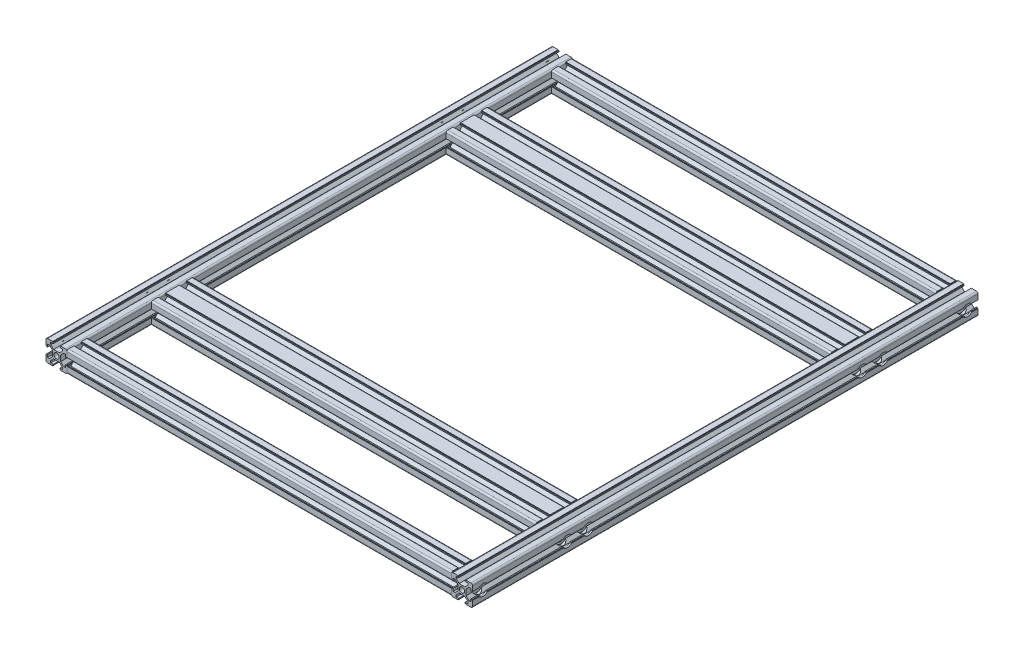
from build123d import *

# Parameters (mm, degrees)
SKETCH1_R                   = 2.5
F_20_X_20_X_R1_5_1_DEPTH    = 385
SKETCH1_ON_SEGMENT_2_R      = 2.5
F_20_X_20_X_R1_5_1_2_DEPTH  = 385
SKETCH110_R                 = 2.5
F_20_X_40_X_R1_5_3_DEPTH    = 385
SKETCH111_R                 = 2.5
F_20_X_40_X_R1_5_4_DEPTH    = 385
SKETCH114_ON_SEGMENT_1_R    = 2.5
F_20_X_20_X_R1_5_24_DEPTH   = 80
SKETCH114_R                 = 2.5
F_20_X_20_X_R1_5_24_2_DEPTH = 300
SKETCH114_ON_SEGMENT_3_R    = 2.5
F_20_X_20_X_R1_5_24_3_DEPTH = 80
SKETCH115_R                 = 2.5
F_20_X_20_X_R1_5_25_DEPTH   = 80
SKETCH115_ON_SEGMENT_2_R    = 2.5
F_20_X_20_X_R1_5_25_2_DEPTH = 300
SKETCH115_ON_SEGMENT_3_R    = 2.5
F_20_X_20_X_R1_5_25_3_DEPTH = 80
BODY_START                  = 80
BODY_7_RUN_ON_DEPTH         = 10
BODY_8_RUN_ON_DEPTH         = 10
BODY_5_RUN_ON_DEPTH         = 10
BODY_10_RUN_ON_DEPTH        = 10
SKETCH_16_R                 = 3.1
SKETCH_16_R_2               = 2.5
CUT_EXTRUDE_1_DEPTH         = 87
CUT_EXTRUDE_START           = -87
SKETCH_18_R                 = 2.5
SKETCH_18_R_2               = 3.1
CUT_EXTRUDE_2_DEPTH         = 87
SKETCH_19_R                 = 5.25
CUT_EXTRUDE_3_DEPTH         = 6.1
SKETCH_20_R                 = 5.25
CUT_EXTRUDE_4_DEPTH         = 6.1


with BuildPart() as part:
    # Sketch1 → 铝型材 20 X 20 X R1.5(1) (new body)
    with BuildSketch(Plane(origin=(-192.5, 0, -230), x_dir=(0, 0, -1), z_dir=(1, 0, 0))):
        with BuildLine():
            Line((-3.6, 10), (-3.6, 9.5))
            Line((-3.6, 9.5), (-3.1, 9.5))
            Line((-3.1, 9.5), (-3.1, 8.5))
            Line((-3.1, 8.5), (-5.5, 8.5))
            Line((-5.5, 8.5), (-5.5, 6.65))
            Line((-5.5, 6.65), (-2.75, 3.9))
            Line((-2.75, 3.9), (2.75, 3.9))
            Line((2.75, 3.9), (5.5, 6.65))
            Line((5.5, 6.65), (5.5, 8.5))
            Line((5.5, 8.5), (3.1, 8.5))
            Line((3.1, 8.5), (3.1, 9.5))
            Line((3.1, 9.5), (3.6, 9.5))
            Line((3.6, 9.5), (3.6, 10))
            Line((3.6, 10), (8.5, 10))
            ThreePointArc((8.5, 10), (9.560660172, 9.560660172), (10, 8.5))
            Line((10, 8.5), (10, 3.6))
            Line((10, 3.6), (9.5, 3.6))
            Line((9.5, 3.6), (9.5, 3.1))
            Line((9.5, 3.1), (8.5, 3.1))
            Line((8.5, 3.1), (8.5, 5.5))
            Line((8.5, 5.5), (6.65, 5.5))
            Line((6.65, 5.5), (3.9, 2.75))
            Line((3.9, 2.75), (3.9, -2.75))
            Line((3.9, -2.75), (6.65, -5.5))
            Line((6.65, -5.5), (8.5, -5.5))
            Line((8.5, -5.5), (8.5, -3.1))
            Line((8.5, -3.1), (9.5, -3.1))
            Line((9.5, -3.1), (9.5, -3.6))
            Line((9.5, -3.6), (10, -3.6))
            Line((10, -3.6), (10, -8.5))
            ThreePointArc((10, -8.5), (9.560660172, -9.560660172), (8.5, -10))
            Line((8.5, -10), (3.6, -10))
            Line((3.6, -10), (3.6, -9.5))
            Line((3.6, -9.5), (3.1, -9.5))
            Line((3.1, -9.5), (3.1, -8.5))
            Line((3.1, -8.5), (5.5, -8.5))
            Line((5.5, -8.5), (5.5, -6.65))
            Line((5.5, -6.65), (2.75, -3.9))
            Line((2.75, -3.9), (-2.75, -3.9))
            Line((-2.75, -3.9), (-5.5, -6.65))
            Line((-5.5, -6.65), (-5.5, -8.5))
            Line((-5.5, -8.5), (-3.1, -8.5))
            Line((-3.1, -8.5), (-3.1, -9.5))
            Line((-3.1, -9.5), (-3.6, -9.5))
            Line((-3.6, -9.5), (-3.6, -10))
            Line((-3.6, -10), (-8.5, -10))
            ThreePointArc((-8.5, -10), (-9.560660172, -9.560660172), (-10, -8.5))
            Line((-10, -8.5), (-10, -3.6))
            Line((-10, -3.6), (-9.5, -3.6))
            Line((-9.5, -3.6), (-9.5, -3.1))
            Line((-9.5, -3.1), (-8.5, -3.1))
            Line((-8.5, -3.1), (-8.5, -5.5))
            Line((-8.5, -5.5), (-6.65, -5.5))
            Line((-6.65, -5.5), (-3.9, -2.75))
            Line((-3.9, -2.75), (-3.9, 2.75))
            Line((-3.9, 2.75), (-6.65, 5.5))
            Line((-6.65, 5.5), (-8.5, 5.5))
            Line((-8.5, 5.5), (-8.5, 3.1))
            Line((-8.5, 3.1), (-9.5, 3.1))
            Line((-9.5, 3.1), (-9.5, 3.6))
            Line((-9.5, 3.6), (-10, 3.6))
            Line((-10, 3.6), (-10, 8.5))
            ThreePointArc((-10, 8.5), (-9.560660172, 9.560660172), (-8.5, 10))
            Line((-8.5, 10), (-3.6, 10))
        make_face()
        Circle(SKETCH1_R, mode=Mode.SUBTRACT)
    extrude(amount=F_20_X_20_X_R1_5_1_DEPTH)

    # Weld Trim 4
    split(bisect_by=Plane(origin=(-182.5, 6.05, 190), x_dir=(0, 1, 0), z_dir=(1, 0, 0)), keep=Keep.TOP)

    # Weld Trim 4 3
    split(bisect_by=Plane(origin=(182.5, 6.05, 190), x_dir=(0, -1, 0), z_dir=(-1, 0, 0)), keep=Keep.TOP)


with BuildPart() as body_2:
    # Sketch1 on segment 2 (carried to segment 2) → 20 X 20 X R1.5_1 2 (new body)
    with BuildSketch(Plane(origin=(-192.5, 0, 230), x_dir=(0, 0, -1), z_dir=(1, 0, 0))):
        with BuildLine():
            Line((-3.6, 10), (-3.6, 9.5))
            Line((-3.6, 9.5), (-3.1, 9.5))
            Line((-3.1, 9.5), (-3.1, 8.5))
            Line((-3.1, 8.5), (-5.5, 8.5))
            Line((-5.5, 8.5), (-5.5, 6.65))
            Line((-5.5, 6.65), (-2.75, 3.9))
            Line((-2.75, 3.9), (2.75, 3.9))
            Line((2.75, 3.9), (5.5, 6.65))
            Line((5.5, 6.65), (5.5, 8.5))
            Line((5.5, 8.5), (3.1, 8.5))
            Line((3.1, 8.5), (3.1, 9.5))
            Line((3.1, 9.5), (3.6, 9.5))
            Line((3.6, 9.5), (3.6, 10))
            Line((3.6, 10), (8.5, 10))
            ThreePointArc((8.5, 10), (9.560660172, 9.560660172), (10, 8.5))
            Line((10, 8.5), (10, 3.6))
            Line((10, 3.6), (9.5, 3.6))
            Line((9.5, 3.6), (9.5, 3.1))
            Line((9.5, 3.1), (8.5, 3.1))
            Line((8.5, 3.1), (8.5, 5.5))
            Line((8.5, 5.5), (6.65, 5.5))
            Line((6.65, 5.5), (3.9, 2.75))
            Line((3.9, 2.75), (3.9, -2.75))
            Line((3.9, -2.75), (6.65, -5.5))
            Line((6.65, -5.5), (8.5, -5.5))
            Line((8.5, -5.5), (8.5, -3.1))
            Line((8.5, -3.1), (9.5, -3.1))
            Line((9.5, -3.1), (9.5, -3.6))
            Line((9.5, -3.6), (10, -3.6))
            Line((10, -3.6), (10, -8.5))
            ThreePointArc((10, -8.5), (9.560660172, -9.560660172), (8.5, -10))
            Line((8.5, -10), (3.6, -10))
            Line((3.6, -10), (3.6, -9.5))
            Line((3.6, -9.5), (3.1, -9.5))
            Line((3.1, -9.5), (3.1, -8.5))
            Line((3.1, -8.5), (5.5, -8.5))
            Line((5.5, -8.5), (5.5, -6.65))
            Line((5.5, -6.65), (2.75, -3.9))
            Line((2.75, -3.9), (-2.75, -3.9))
            Line((-2.75, -3.9), (-5.5, -6.65))
            Line((-5.5, -6.65), (-5.5, -8.5))
            Line((-5.5, -8.5), (-3.1, -8.5))
            Line((-3.1, -8.5), (-3.1, -9.5))
            Line((-3.1, -9.5), (-3.6, -9.5))
            Line((-3.6, -9.5), (-3.6, -10))
            Line((-3.6, -10), (-8.5, -10))
            ThreePointArc((-8.5, -10), (-9.560660172, -9.560660172), (-10, -8.5))
            Line((-10, -8.5), (-10, -3.6))
            Line((-10, -3.6), (-9.5, -3.6))
            Line((-9.5, -3.6), (-9.5, -3.1))
            Line((-9.5, -3.1), (-8.5, -3.1))
            Line((-8.5, -3.1), (-8.5, -5.5))
            Line((-8.5, -5.5), (-6.65, -5.5))
            Line((-6.65, -5.5), (-3.9, -2.75))
            Line((-3.9, -2.75), (-3.9, 2.75))
            Line((-3.9, 2.75), (-6.65, 5.5))
            Line((-6.65, 5.5), (-8.5, 5.5))
            Line((-8.5, 5.5), (-8.5, 3.1))
            Line((-8.5, 3.1), (-9.5, 3.1))
            Line((-9.5, 3.1), (-9.5, 3.6))
            Line((-9.5, 3.6), (-10, 3.6))
            Line((-10, 3.6), (-10, 8.5))
            ThreePointArc((-10, 8.5), (-9.560660172, 9.560660172), (-8.5, 10))
            Line((-8.5, 10), (-3.6, 10))
        make_face()
        Circle(SKETCH1_ON_SEGMENT_2_R, mode=Mode.SUBTRACT)
    extrude(amount=F_20_X_20_X_R1_5_1_2_DEPTH)

    # Weld Trim 4
    split(bisect_by=Plane(origin=(-182.5, 6.05, 190), x_dir=(0, 1, 0), z_dir=(1, 0, 0)), keep=Keep.TOP)

    # Weld Trim 4 3
    split(bisect_by=Plane(origin=(182.5, 6.05, 190), x_dir=(0, -1, 0), z_dir=(-1, 0, 0)), keep=Keep.TOP)


with BuildPart() as body_3:
    # Sketch110 → 铝型材 20 X 40 X R1.5(3) (new body)
    with BuildSketch(Plane(origin=(-192.5, 0, 150), x_dir=(0, 1, 0), z_dir=(1, 0, 0))):
        with BuildLine():
            Line((-3.6, 10), (-3.6, 9.5))
            Line((-3.6, 9.5), (-3.1, 9.5))
            Line((-3.1, 9.5), (-3.1, 8.5))
            Line((-3.1, 8.5), (-5.5, 8.5))
            Line((-5.5, 8.5), (-5.5, 6.65))
            Line((-5.5, 6.65), (-2.75, 3.9))
            Line((-2.75, 3.9), (2.75, 3.9))
            Line((2.75, 3.9), (5.5, 6.65))
            Line((5.5, 6.65), (5.5, 8.5))
            Line((5.5, 8.5), (3.1, 8.5))
            Line((3.1, 8.5), (3.1, 9.5))
            Line((3.1, 9.5), (3.6, 9.5))
            Line((3.6, 9.5), (3.6, 10))
            Line((3.6, 10), (8.5, 10))
            ThreePointArc((8.5, 10), (9.560660172, 9.560660172), (10, 8.5))
            Line((10, 8.5), (10, 3.6))
            Line((10, 3.6), (9.5, 3.6))
            Line((9.5, 3.6), (9.5, 3.1))
            Line((9.5, 3.1), (8.5, 3.1))
            Line((8.5, 3.1), (8.5, 5.5))
            Line((8.5, 5.5), (6.65, 5.5))
            Line((6.65, 5.5), (3.9, 2.75))
            Line((3.9, 2.75), (3.9, -2.75))
            Line((3.9, -2.75), (6.65, -5.5))
            Line((6.65, -5.5), (8.5, -5.5))
            Line((8.5, -5.5), (8.5, -3.1))
            Line((8.5, -3.1), (9.5, -3.1))
            Line((9.5, -3.1), (9.5, -3.6))
            Line((9.5, -3.6), (10, -3.6))
            Line((10, -3.6), (10, -16.4))
            Line((10, -16.4), (9.5, -16.4))
            Line((9.5, -16.4), (9.5, -16.9))
            Line((9.5, -16.9), (8.5, -16.9))
            Line((8.5, -16.9), (8.5, -14.5))
            Line((8.5, -14.5), (6.65, -14.5))
            Line((6.65, -14.5), (3.9, -17.25))
            Line((3.9, -17.25), (3.9, -22.75))
            Line((3.9, -22.75), (6.65, -25.5))
            Line((6.65, -25.5), (8.5, -25.5))
            Line((8.5, -25.5), (8.5, -23.1))
            Line((8.5, -23.1), (9.5, -23.1))
            Line((9.5, -23.1), (9.5, -23.6))
            Line((9.5, -23.6), (10, -23.6))
            Line((10, -23.6), (10, -28.5))
            ThreePointArc((10, -28.5), (9.560660172, -29.560660172), (8.5, -30))
            Line((8.5, -30), (3.6, -30))
            Line((3.6, -30), (3.6, -29.5))
            Line((3.6, -29.5), (3.1, -29.5))
            Line((3.1, -29.5), (3.1, -28.5))
            Line((3.1, -28.5), (5.5, -28.5))
            Line((5.5, -28.5), (5.5, -26.65))
            Line((5.5, -26.65), (2.75, -23.9))
            Line((2.75, -23.9), (-2.75, -23.9))
            Line((-2.75, -23.9), (-5.5, -26.65))
            Line((-5.5, -26.65), (-5.5, -28.5))
            Line((-5.5, -28.5), (-3.1, -28.5))
            Line((-3.1, -28.5), (-3.1, -29.5))
            Line((-3.1, -29.5), (-3.6, -29.5))
            Line((-3.6, -29.5), (-3.6, -30))
            Line((-3.6, -30), (-8.5, -30))
            ThreePointArc((-8.5, -30), (-9.560660172, -29.560660172), (-10, -28.5))
            Line((-10, -28.5), (-10, -23.6))
            Line((-10, -23.6), (-9.5, -23.6))
            Line((-9.5, -23.6), (-9.5, -23.1))
            Line((-9.5, -23.1), (-8.5, -23.1))
            Line((-8.5, -23.1), (-8.5, -25.5))
            Line((-8.5, -25.5), (-6.65, -25.5))
            Line((-6.65, -25.5), (-3.9, -22.75))
            Line((-3.9, -22.75), (-3.9, -17.25))
            Line((-3.9, -17.25), (-6.65, -14.5))
            Line((-6.65, -14.5), (-8.5, -14.5))
            Line((-8.5, -14.5), (-8.5, -16.9))
            Line((-8.5, -16.9), (-9.5, -16.9))
            Line((-9.5, -16.9), (-9.5, -16.4))
            Line((-9.5, -16.4), (-10, -16.4))
            Line((-10, -16.4), (-10, -3.6))
            Line((-10, -3.6), (-9.5, -3.6))
            Line((-9.5, -3.6), (-9.5, -3.1))
            Line((-9.5, -3.1), (-8.5, -3.1))
            Line((-8.5, -3.1), (-8.5, -5.5))
            Line((-8.5, -5.5), (-6.65, -5.5))
            Line((-6.65, -5.5), (-3.9, -2.75))
            Line((-3.9, -2.75), (-3.9, 2.75))
            Line((-3.9, 2.75), (-6.65, 5.5))
            Line((-6.65, 5.5), (-8.5, 5.5))
            Line((-8.5, 5.5), (-8.5, 3.1))
            Line((-8.5, 3.1), (-9.5, 3.1))
            Line((-9.5, 3.1), (-9.5, 3.6))
            Line((-9.5, 3.6), (-10, 3.6))
            Line((-10, 3.6), (-10, 8.5))
            ThreePointArc((-10, 8.5), (-9.560660172, 9.560660172), (-8.5, 10))
            Line((-8.5, 10), (-3.6, 10))
        make_face()
        Circle(SKETCH110_R, mode=Mode.SUBTRACT)
        with Locations((0, -20)):
            Circle(SKETCH110_R, mode=Mode.SUBTRACT)
        Polygon((8.85, -10), (2.75, -3.9), (-2.75, -3.9), (-8.85, -10), (-2.75, -16.1), (2.75, -16.1), align=None, mode=Mode.SUBTRACT)
    extrude(amount=F_20_X_40_X_R1_5_3_DEPTH)

    # Weld Trim 3
    split(bisect_by=Plane(origin=(-182.5, 6.05, 190), x_dir=(0, 1, 0), z_dir=(1, 0, 0)), keep=Keep.TOP)

    # Weld Trim 3 3
    split(bisect_by=Plane(origin=(182.5, 6.05, 0), x_dir=(0, -1, 0), z_dir=(-1, 0, 0)), keep=Keep.TOP)


with BuildPart() as body_4:
    # Sketch111 → 铝型材 20 X 40 X R1.5(4) (new body)
    with BuildSketch(Plane(origin=(-192.5, 0, -150), x_dir=(0, -1, 0), z_dir=(1, 0, 0))):
        with BuildLine():
            Line((-3.6, 10), (-3.6, 9.5))
            Line((-3.6, 9.5), (-3.1, 9.5))
            Line((-3.1, 9.5), (-3.1, 8.5))
            Line((-3.1, 8.5), (-5.5, 8.5))
            Line((-5.5, 8.5), (-5.5, 6.65))
            Line((-5.5, 6.65), (-2.75, 3.9))
            Line((-2.75, 3.9), (2.75, 3.9))
            Line((2.75, 3.9), (5.5, 6.65))
            Line((5.5, 6.65), (5.5, 8.5))
            Line((5.5, 8.5), (3.1, 8.5))
            Line((3.1, 8.5), (3.1, 9.5))
            Line((3.1, 9.5), (3.6, 9.5))
            Line((3.6, 9.5), (3.6, 10))
            Line((3.6, 10), (8.5, 10))
            ThreePointArc((8.5, 10), (9.560660172, 9.560660172), (10, 8.5))
            Line((10, 8.5), (10, 3.6))
            Line((10, 3.6), (9.5, 3.6))
            Line((9.5, 3.6), (9.5, 3.1))
            Line((9.5, 3.1), (8.5, 3.1))
            Line((8.5, 3.1), (8.5, 5.5))
            Line((8.5, 5.5), (6.65, 5.5))
            Line((6.65, 5.5), (3.9, 2.75))
            Line((3.9, 2.75), (3.9, -2.75))
            Line((3.9, -2.75), (6.65, -5.5))
            Line((6.65, -5.5), (8.5, -5.5))
            Line((8.5, -5.5), (8.5, -3.1))
            Line((8.5, -3.1), (9.5, -3.1))
            Line((9.5, -3.1), (9.5, -3.6))
            Line((9.5, -3.6), (10, -3.6))
            Line((10, -3.6), (10, -16.4))
            Line((10, -16.4), (9.5, -16.4))
            Line((9.5, -16.4), (9.5, -16.9))
            Line((9.5, -16.9), (8.5, -16.9))
            Line((8.5, -16.9), (8.5, -14.5))
            Line((8.5, -14.5), (6.65, -14.5))
            Line((6.65, -14.5), (3.9, -17.25))
            Line((3.9, -17.25), (3.9, -22.75))
            Line((3.9, -22.75), (6.65, -25.5))
            Line((6.65, -25.5), (8.5, -25.5))
            Line((8.5, -25.5), (8.5, -23.1))
            Line((8.5, -23.1), (9.5, -23.1))
            Line((9.5, -23.1), (9.5, -23.6))
            Line((9.5, -23.6), (10, -23.6))
            Line((10, -23.6), (10, -28.5))
            ThreePointArc((10, -28.5), (9.560660172, -29.560660172), (8.5, -30))
            Line((8.5, -30), (3.6, -30))
            Line((3.6, -30), (3.6, -29.5))
            Line((3.6, -29.5), (3.1, -29.5))
            Line((3.1, -29.5), (3.1, -28.5))
            Line((3.1, -28.5), (5.5, -28.5))
            Line((5.5, -28.5), (5.5, -26.65))
            Line((5.5, -26.65), (2.75, -23.9))
            Line((2.75, -23.9), (-2.75, -23.9))
            Line((-2.75, -23.9), (-5.5, -26.65))
            Line((-5.5, -26.65), (-5.5, -28.5))
            Line((-5.5, -28.5), (-3.1, -28.5))
            Line((-3.1, -28.5), (-3.1, -29.5))
            Line((-3.1, -29.5), (-3.6, -29.5))
            Line((-3.6, -29.5), (-3.6, -30))
            Line((-3.6, -30), (-8.5, -30))
            ThreePointArc((-8.5, -30), (-9.560660172, -29.560660172), (-10, -28.5))
            Line((-10, -28.5), (-10, -23.6))
            Line((-10, -23.6), (-9.5, -23.6))
            Line((-9.5, -23.6), (-9.5, -23.1))
            Line((-9.5, -23.1), (-8.5, -23.1))
            Line((-8.5, -23.1), (-8.5, -25.5))
            Line((-8.5, -25.5), (-6.65, -25.5))
            Line((-6.65, -25.5), (-3.9, -22.75))
            Line((-3.9, -22.75), (-3.9, -17.25))
            Line((-3.9, -17.25), (-6.65, -14.5))
            Line((-6.65, -14.5), (-8.5, -14.5))
            Line((-8.5, -14.5), (-8.5, -16.9))
            Line((-8.5, -16.9), (-9.5, -16.9))
            Line((-9.5, -16.9), (-9.5, -16.4))
            Line((-9.5, -16.4), (-10, -16.4))
            Line((-10, -16.4), (-10, -3.6))
            Line((-10, -3.6), (-9.5, -3.6))
            Line((-9.5, -3.6), (-9.5, -3.1))
            Line((-9.5, -3.1), (-8.5, -3.1))
            Line((-8.5, -3.1), (-8.5, -5.5))
            Line((-8.5, -5.5), (-6.65, -5.5))
            Line((-6.65, -5.5), (-3.9, -2.75))
            Line((-3.9, -2.75), (-3.9, 2.75))
            Line((-3.9, 2.75), (-6.65, 5.5))
            Line((-6.65, 5.5), (-8.5, 5.5))
            Line((-8.5, 5.5), (-8.5, 3.1))
            Line((-8.5, 3.1), (-9.5, 3.1))
            Line((-9.5, 3.1), (-9.5, 3.6))
            Line((-9.5, 3.6), (-10, 3.6))
            Line((-10, 3.6), (-10, 8.5))
            ThreePointArc((-10, 8.5), (-9.560660172, 9.560660172), (-8.5, 10))
            Line((-8.5, 10), (-3.6, 10))
        make_face()
        Circle(SKETCH111_R, mode=Mode.SUBTRACT)
        with Locations((0, -20)):
            Circle(SKETCH111_R, mode=Mode.SUBTRACT)
        Polygon((8.85, -10), (2.75, -3.9), (-2.75, -3.9), (-8.85, -10), (-2.75, -16.1), (2.75, -16.1), align=None, mode=Mode.SUBTRACT)
    extrude(amount=F_20_X_40_X_R1_5_4_DEPTH)

    # Weld Trim 3
    split(bisect_by=Plane(origin=(-182.5, 6.05, 190), x_dir=(0, 1, 0), z_dir=(1, 0, 0)), keep=Keep.TOP)

    # Weld Trim 3 3
    split(bisect_by=Plane(origin=(182.5, 6.05, 0), x_dir=(0, -1, 0), z_dir=(-1, 0, 0)), keep=Keep.TOP)


with BuildPart() as body_5:
    # Sketch114 on segment 1 (carried to segment 1) → 铝型材 20 X 20 X R1.5(24) (new body)
    with BuildSketch(Plane(origin=(-192.5, 0, -230), x_dir=(1, 0, 0), z_dir=(0, 0, 1))):
        with BuildLine():
            Line((-3.6, 10), (-3.6, 9.5))
            Line((-3.6, 9.5), (-3.1, 9.5))
            Line((-3.1, 9.5), (-3.1, 8.5))
            Line((-3.1, 8.5), (-5.5, 8.5))
            Line((-5.5, 8.5), (-5.5, 6.65))
            Line((-5.5, 6.65), (-2.75, 3.9))
            Line((-2.75, 3.9), (2.75, 3.9))
            Line((2.75, 3.9), (5.5, 6.65))
            Line((5.5, 6.65), (5.5, 8.5))
            Line((5.5, 8.5), (3.1, 8.5))
            Line((3.1, 8.5), (3.1, 9.5))
            Line((3.1, 9.5), (3.6, 9.5))
            Line((3.6, 9.5), (3.6, 10))
            Line((3.6, 10), (8.5, 10))
            ThreePointArc((8.5, 10), (9.560660172, 9.560660172), (10, 8.5))
            Line((10, 8.5), (10, 3.6))
            Line((10, 3.6), (9.5, 3.6))
            Line((9.5, 3.6), (9.5, 3.1))
            Line((9.5, 3.1), (8.5, 3.1))
            Line((8.5, 3.1), (8.5, 5.5))
            Line((8.5, 5.5), (6.65, 5.5))
            Line((6.65, 5.5), (3.9, 2.75))
            Line((3.9, 2.75), (3.9, -2.75))
            Line((3.9, -2.75), (6.65, -5.5))
            Line((6.65, -5.5), (8.5, -5.5))
            Line((8.5, -5.5), (8.5, -3.1))
            Line((8.5, -3.1), (9.5, -3.1))
            Line((9.5, -3.1), (9.5, -3.6))
            Line((9.5, -3.6), (10, -3.6))
            Line((10, -3.6), (10, -8.5))
            ThreePointArc((10, -8.5), (9.560660172, -9.560660172), (8.5, -10))
            Line((8.5, -10), (3.6, -10))
            Line((3.6, -10), (3.6, -9.5))
            Line((3.6, -9.5), (3.1, -9.5))
            Line((3.1, -9.5), (3.1, -8.5))
            Line((3.1, -8.5), (5.5, -8.5))
            Line((5.5, -8.5), (5.5, -6.65))
            Line((5.5, -6.65), (2.75, -3.9))
            Line((2.75, -3.9), (-2.75, -3.9))
            Line((-2.75, -3.9), (-5.5, -6.65))
            Line((-5.5, -6.65), (-5.5, -8.5))
            Line((-5.5, -8.5), (-3.1, -8.5))
            Line((-3.1, -8.5), (-3.1, -9.5))
            Line((-3.1, -9.5), (-3.6, -9.5))
            Line((-3.6, -9.5), (-3.6, -10))
            Line((-3.6, -10), (-8.5, -10))
            ThreePointArc((-8.5, -10), (-9.560660172, -9.560660172), (-10, -8.5))
            Line((-10, -8.5), (-10, -3.6))
            Line((-10, -3.6), (-9.5, -3.6))
            Line((-9.5, -3.6), (-9.5, -3.1))
            Line((-9.5, -3.1), (-8.5, -3.1))
            Line((-8.5, -3.1), (-8.5, -5.5))
            Line((-8.5, -5.5), (-6.65, -5.5))
            Line((-6.65, -5.5), (-3.9, -2.75))
            Line((-3.9, -2.75), (-3.9, 2.75))
            Line((-3.9, 2.75), (-6.65, 5.5))
            Line((-6.65, 5.5), (-8.5, 5.5))
            Line((-8.5, 5.5), (-8.5, 3.1))
            Line((-8.5, 3.1), (-9.5, 3.1))
            Line((-9.5, 3.1), (-9.5, 3.6))
            Line((-9.5, 3.6), (-10, 3.6))
            Line((-10, 3.6), (-10, 8.5))
            ThreePointArc((-10, 8.5), (-9.560660172, 9.560660172), (-8.5, 10))
            Line((-8.5, 10), (-3.6, 10))
        make_face()
        Circle(SKETCH114_ON_SEGMENT_1_R, mode=Mode.SUBTRACT)
    extrude(amount=F_20_X_20_X_R1_5_24_DEPTH)

    # Sketch114 on segment 1 (carried to segment 1) → body 5 run on (add)
    with BuildSketch(Plane(origin=(-192.5, 0, -230), x_dir=(1, 0, 0), z_dir=(0, 0, 1))):
        with BuildLine():
            Line((-3.6, 10), (-3.6, 9.5))
            Line((-3.6, 9.5), (-3.1, 9.5))
            Line((-3.1, 9.5), (-3.1, 8.5))
            Line((-3.1, 8.5), (-5.5, 8.5))
            Line((-5.5, 8.5), (-5.5, 6.65))
            Line((-5.5, 6.65), (-2.75, 3.9))
            Line((-2.75, 3.9), (2.75, 3.9))
            Line((2.75, 3.9), (5.5, 6.65))
            Line((5.5, 6.65), (5.5, 8.5))
            Line((5.5, 8.5), (3.1, 8.5))
            Line((3.1, 8.5), (3.1, 9.5))
            Line((3.1, 9.5), (3.6, 9.5))
            Line((3.6, 9.5), (3.6, 10))
            Line((3.6, 10), (8.5, 10))
            ThreePointArc((8.5, 10), (9.560660172, 9.560660172), (10, 8.5))
            Line((10, 8.5), (10, 3.6))
            Line((10, 3.6), (9.5, 3.6))
            Line((9.5, 3.6), (9.5, 3.1))
            Line((9.5, 3.1), (8.5, 3.1))
            Line((8.5, 3.1), (8.5, 5.5))
            Line((8.5, 5.5), (6.65, 5.5))
            Line((6.65, 5.5), (3.9, 2.75))
            Line((3.9, 2.75), (3.9, -2.75))
            Line((3.9, -2.75), (6.65, -5.5))
            Line((6.65, -5.5), (8.5, -5.5))
            Line((8.5, -5.5), (8.5, -3.1))
            Line((8.5, -3.1), (9.5, -3.1))
            Line((9.5, -3.1), (9.5, -3.6))
            Line((9.5, -3.6), (10, -3.6))
            Line((10, -3.6), (10, -8.5))
            ThreePointArc((10, -8.5), (9.560660172, -9.560660172), (8.5, -10))
            Line((8.5, -10), (3.6, -10))
            Line((3.6, -10), (3.6, -9.5))
            Line((3.6, -9.5), (3.1, -9.5))
            Line((3.1, -9.5), (3.1, -8.5))
            Line((3.1, -8.5), (5.5, -8.5))
            Line((5.5, -8.5), (5.5, -6.65))
            Line((5.5, -6.65), (2.75, -3.9))
            Line((2.75, -3.9), (-2.75, -3.9))
            Line((-2.75, -3.9), (-5.5, -6.65))
            Line((-5.5, -6.65), (-5.5, -8.5))
            Line((-5.5, -8.5), (-3.1, -8.5))
            Line((-3.1, -8.5), (-3.1, -9.5))
            Line((-3.1, -9.5), (-3.6, -9.5))
            Line((-3.6, -9.5), (-3.6, -10))
            Line((-3.6, -10), (-8.5, -10))
            ThreePointArc((-8.5, -10), (-9.560660172, -9.560660172), (-10, -8.5))
            Line((-10, -8.5), (-10, -3.6))
            Line((-10, -3.6), (-9.5, -3.6))
            Line((-9.5, -3.6), (-9.5, -3.1))
            Line((-9.5, -3.1), (-8.5, -3.1))
            Line((-8.5, -3.1), (-8.5, -5.5))
            Line((-8.5, -5.5), (-6.65, -5.5))
            Line((-6.65, -5.5), (-3.9, -2.75))
            Line((-3.9, -2.75), (-3.9, 2.75))
            Line((-3.9, 2.75), (-6.65, 5.5))
            Line((-6.65, 5.5), (-8.5, 5.5))
            Line((-8.5, 5.5), (-8.5, 3.1))
            Line((-8.5, 3.1), (-9.5, 3.1))
            Line((-9.5, 3.1), (-9.5, 3.6))
            Line((-9.5, 3.6), (-10, 3.6))
            Line((-10, 3.6), (-10, 8.5))
            ThreePointArc((-10, 8.5), (-9.560660172, 9.560660172), (-8.5, 10))
            Line((-8.5, 10), (-3.6, 10))
        make_face()
        Circle(SKETCH114_ON_SEGMENT_1_R, mode=Mode.SUBTRACT)
    extrude(amount=-BODY_5_RUN_ON_DEPTH)


with BuildPart() as body_6:
    # Sketch114 → 20 X 20 X R1.5_24 2 (new body)
    with BuildSketch(Plane(origin=(-192.5, 0, 150), x_dir=(1, 0, 0), z_dir=(0, 0, 1))):
        with BuildLine():
            Line((-3.6, 10), (-3.6, 9.5))
            Line((-3.6, 9.5), (-3.1, 9.5))
            Line((-3.1, 9.5), (-3.1, 8.5))
            Line((-3.1, 8.5), (-5.5, 8.5))
            Line((-5.5, 8.5), (-5.5, 6.65))
            Line((-5.5, 6.65), (-2.75, 3.9))
            Line((-2.75, 3.9), (2.75, 3.9))
            Line((2.75, 3.9), (5.5, 6.65))
            Line((5.5, 6.65), (5.5, 8.5))
            Line((5.5, 8.5), (3.1, 8.5))
            Line((3.1, 8.5), (3.1, 9.5))
            Line((3.1, 9.5), (3.6, 9.5))
            Line((3.6, 9.5), (3.6, 10))
            Line((3.6, 10), (8.5, 10))
            ThreePointArc((8.5, 10), (9.560660172, 9.560660172), (10, 8.5))
            Line((10, 8.5), (10, 3.6))
            Line((10, 3.6), (9.5, 3.6))
            Line((9.5, 3.6), (9.5, 3.1))
            Line((9.5, 3.1), (8.5, 3.1))
            Line((8.5, 3.1), (8.5, 5.5))
            Line((8.5, 5.5), (6.65, 5.5))
            Line((6.65, 5.5), (3.9, 2.75))
            Line((3.9, 2.75), (3.9, -2.75))
            Line((3.9, -2.75), (6.65, -5.5))
            Line((6.65, -5.5), (8.5, -5.5))
            Line((8.5, -5.5), (8.5, -3.1))
            Line((8.5, -3.1), (9.5, -3.1))
            Line((9.5, -3.1), (9.5, -3.6))
            Line((9.5, -3.6), (10, -3.6))
            Line((10, -3.6), (10, -8.5))
            ThreePointArc((10, -8.5), (9.560660172, -9.560660172), (8.5, -10))
            Line((8.5, -10), (3.6, -10))
            Line((3.6, -10), (3.6, -9.5))
            Line((3.6, -9.5), (3.1, -9.5))
            Line((3.1, -9.5), (3.1, -8.5))
            Line((3.1, -8.5), (5.5, -8.5))
            Line((5.5, -8.5), (5.5, -6.65))
            Line((5.5, -6.65), (2.75, -3.9))
            Line((2.75, -3.9), (-2.75, -3.9))
            Line((-2.75, -3.9), (-5.5, -6.65))
            Line((-5.5, -6.65), (-5.5, -8.5))
            Line((-5.5, -8.5), (-3.1, -8.5))
            Line((-3.1, -8.5), (-3.1, -9.5))
            Line((-3.1, -9.5), (-3.6, -9.5))
            Line((-3.6, -9.5), (-3.6, -10))
            Line((-3.6, -10), (-8.5, -10))
            ThreePointArc((-8.5, -10), (-9.560660172, -9.560660172), (-10, -8.5))
            Line((-10, -8.5), (-10, -3.6))
            Line((-10, -3.6), (-9.5, -3.6))
            Line((-9.5, -3.6), (-9.5, -3.1))
            Line((-9.5, -3.1), (-8.5, -3.1))
            Line((-8.5, -3.1), (-8.5, -5.5))
            Line((-8.5, -5.5), (-6.65, -5.5))
            Line((-6.65, -5.5), (-3.9, -2.75))
            Line((-3.9, -2.75), (-3.9, 2.75))
            Line((-3.9, 2.75), (-6.65, 5.5))
            Line((-6.65, 5.5), (-8.5, 5.5))
            Line((-8.5, 5.5), (-8.5, 3.1))
            Line((-8.5, 3.1), (-9.5, 3.1))
            Line((-9.5, 3.1), (-9.5, 3.6))
            Line((-9.5, 3.6), (-10, 3.6))
            Line((-10, 3.6), (-10, 8.5))
            ThreePointArc((-10, 8.5), (-9.560660172, 9.560660172), (-8.5, 10))
            Line((-8.5, 10), (-3.6, 10))
        make_face()
        Circle(SKETCH114_R, mode=Mode.SUBTRACT)
    extrude(amount=-F_20_X_20_X_R1_5_24_2_DEPTH)


with BuildPart() as body_7:
    # Sketch114 on segment 3 (carried to segment 3) → 20 X 20 X R1.5_24 3 (new body)
    with BuildSketch(Plane(origin=(-192.5, 0, 150), x_dir=(1, 0, 0), z_dir=(0, 0, 1))):
        with BuildLine():
            Line((-3.6, 10), (-3.6, 9.5))
            Line((-3.6, 9.5), (-3.1, 9.5))
            Line((-3.1, 9.5), (-3.1, 8.5))
            Line((-3.1, 8.5), (-5.5, 8.5))
            Line((-5.5, 8.5), (-5.5, 6.65))
            Line((-5.5, 6.65), (-2.75, 3.9))
            Line((-2.75, 3.9), (2.75, 3.9))
            Line((2.75, 3.9), (5.5, 6.65))
            Line((5.5, 6.65), (5.5, 8.5))
            Line((5.5, 8.5), (3.1, 8.5))
            Line((3.1, 8.5), (3.1, 9.5))
            Line((3.1, 9.5), (3.6, 9.5))
            Line((3.6, 9.5), (3.6, 10))
            Line((3.6, 10), (8.5, 10))
            ThreePointArc((8.5, 10), (9.560660172, 9.560660172), (10, 8.5))
            Line((10, 8.5), (10, 3.6))
            Line((10, 3.6), (9.5, 3.6))
            Line((9.5, 3.6), (9.5, 3.1))
            Line((9.5, 3.1), (8.5, 3.1))
            Line((8.5, 3.1), (8.5, 5.5))
            Line((8.5, 5.5), (6.65, 5.5))
            Line((6.65, 5.5), (3.9, 2.75))
            Line((3.9, 2.75), (3.9, -2.75))
            Line((3.9, -2.75), (6.65, -5.5))
            Line((6.65, -5.5), (8.5, -5.5))
            Line((8.5, -5.5), (8.5, -3.1))
            Line((8.5, -3.1), (9.5, -3.1))
            Line((9.5, -3.1), (9.5, -3.6))
            Line((9.5, -3.6), (10, -3.6))
            Line((10, -3.6), (10, -8.5))
            ThreePointArc((10, -8.5), (9.560660172, -9.560660172), (8.5, -10))
            Line((8.5, -10), (3.6, -10))
            Line((3.6, -10), (3.6, -9.5))
            Line((3.6, -9.5), (3.1, -9.5))
            Line((3.1, -9.5), (3.1, -8.5))
            Line((3.1, -8.5), (5.5, -8.5))
            Line((5.5, -8.5), (5.5, -6.65))
            Line((5.5, -6.65), (2.75, -3.9))
            Line((2.75, -3.9), (-2.75, -3.9))
            Line((-2.75, -3.9), (-5.5, -6.65))
            Line((-5.5, -6.65), (-5.5, -8.5))
            Line((-5.5, -8.5), (-3.1, -8.5))
            Line((-3.1, -8.5), (-3.1, -9.5))
            Line((-3.1, -9.5), (-3.6, -9.5))
            Line((-3.6, -9.5), (-3.6, -10))
            Line((-3.6, -10), (-8.5, -10))
            ThreePointArc((-8.5, -10), (-9.560660172, -9.560660172), (-10, -8.5))
            Line((-10, -8.5), (-10, -3.6))
            Line((-10, -3.6), (-9.5, -3.6))
            Line((-9.5, -3.6), (-9.5, -3.1))
            Line((-9.5, -3.1), (-8.5, -3.1))
            Line((-8.5, -3.1), (-8.5, -5.5))
            Line((-8.5, -5.5), (-6.65, -5.5))
            Line((-6.65, -5.5), (-3.9, -2.75))
            Line((-3.9, -2.75), (-3.9, 2.75))
            Line((-3.9, 2.75), (-6.65, 5.5))
            Line((-6.65, 5.5), (-8.5, 5.5))
            Line((-8.5, 5.5), (-8.5, 3.1))
            Line((-8.5, 3.1), (-9.5, 3.1))
            Line((-9.5, 3.1), (-9.5, 3.6))
            Line((-9.5, 3.6), (-10, 3.6))
            Line((-10, 3.6), (-10, 8.5))
            ThreePointArc((-10, 8.5), (-9.560660172, 9.560660172), (-8.5, 10))
            Line((-8.5, 10), (-3.6, 10))
        make_face()
        Circle(SKETCH114_ON_SEGMENT_3_R, mode=Mode.SUBTRACT)
    extrude(amount=F_20_X_20_X_R1_5_24_3_DEPTH)

    # Sketch114 on segment 3 (carried to segment 3) → body 7 run on (add)
    with BuildSketch(Plane(origin=(-192.5, 0, 150), x_dir=(1, 0, 0), z_dir=(0, 0, 1)).offset(BODY_START)):
        with BuildLine():
            Line((-3.6, 10), (-3.6, 9.5))
            Line((-3.6, 9.5), (-3.1, 9.5))
            Line((-3.1, 9.5), (-3.1, 8.5))
            Line((-3.1, 8.5), (-5.5, 8.5))
            Line((-5.5, 8.5), (-5.5, 6.65))
            Line((-5.5, 6.65), (-2.75, 3.9))
            Line((-2.75, 3.9), (2.75, 3.9))
            Line((2.75, 3.9), (5.5, 6.65))
            Line((5.5, 6.65), (5.5, 8.5))
            Line((5.5, 8.5), (3.1, 8.5))
            Line((3.1, 8.5), (3.1, 9.5))
            Line((3.1, 9.5), (3.6, 9.5))
            Line((3.6, 9.5), (3.6, 10))
            Line((3.6, 10), (8.5, 10))
            ThreePointArc((8.5, 10), (9.560660172, 9.560660172), (10, 8.5))
            Line((10, 8.5), (10, 3.6))
            Line((10, 3.6), (9.5, 3.6))
            Line((9.5, 3.6), (9.5, 3.1))
            Line((9.5, 3.1), (8.5, 3.1))
            Line((8.5, 3.1), (8.5, 5.5))
            Line((8.5, 5.5), (6.65, 5.5))
            Line((6.65, 5.5), (3.9, 2.75))
            Line((3.9, 2.75), (3.9, -2.75))
            Line((3.9, -2.75), (6.65, -5.5))
            Line((6.65, -5.5), (8.5, -5.5))
            Line((8.5, -5.5), (8.5, -3.1))
            Line((8.5, -3.1), (9.5, -3.1))
            Line((9.5, -3.1), (9.5, -3.6))
            Line((9.5, -3.6), (10, -3.6))
            Line((10, -3.6), (10, -8.5))
            ThreePointArc((10, -8.5), (9.560660172, -9.560660172), (8.5, -10))
            Line((8.5, -10), (3.6, -10))
            Line((3.6, -10), (3.6, -9.5))
            Line((3.6, -9.5), (3.1, -9.5))
            Line((3.1, -9.5), (3.1, -8.5))
            Line((3.1, -8.5), (5.5, -8.5))
            Line((5.5, -8.5), (5.5, -6.65))
            Line((5.5, -6.65), (2.75, -3.9))
            Line((2.75, -3.9), (-2.75, -3.9))
            Line((-2.75, -3.9), (-5.5, -6.65))
            Line((-5.5, -6.65), (-5.5, -8.5))
            Line((-5.5, -8.5), (-3.1, -8.5))
            Line((-3.1, -8.5), (-3.1, -9.5))
            Line((-3.1, -9.5), (-3.6, -9.5))
            Line((-3.6, -9.5), (-3.6, -10))
            Line((-3.6, -10), (-8.5, -10))
            ThreePointArc((-8.5, -10), (-9.560660172, -9.560660172), (-10, -8.5))
            Line((-10, -8.5), (-10, -3.6))
            Line((-10, -3.6), (-9.5, -3.6))
            Line((-9.5, -3.6), (-9.5, -3.1))
            Line((-9.5, -3.1), (-8.5, -3.1))
            Line((-8.5, -3.1), (-8.5, -5.5))
            Line((-8.5, -5.5), (-6.65, -5.5))
            Line((-6.65, -5.5), (-3.9, -2.75))
            Line((-3.9, -2.75), (-3.9, 2.75))
            Line((-3.9, 2.75), (-6.65, 5.5))
            Line((-6.65, 5.5), (-8.5, 5.5))
            Line((-8.5, 5.5), (-8.5, 3.1))
            Line((-8.5, 3.1), (-9.5, 3.1))
            Line((-9.5, 3.1), (-9.5, 3.6))
            Line((-9.5, 3.6), (-10, 3.6))
            Line((-10, 3.6), (-10, 8.5))
            ThreePointArc((-10, 8.5), (-9.560660172, 9.560660172), (-8.5, 10))
            Line((-8.5, 10), (-3.6, 10))
        make_face()
        Circle(SKETCH114_ON_SEGMENT_3_R, mode=Mode.SUBTRACT)
    extrude(amount=BODY_7_RUN_ON_DEPTH)


with BuildPart() as body_8:
    # Sketch115 → 铝型材 20 X 20 X R1.5(25) (new body)
    with BuildSketch(Plane(origin=(192.5, 0, 230), x_dir=(-1, 0, 0), z_dir=(0, 0, -1))):
        with BuildLine():
            Line((-3.6, 10), (-3.6, 9.5))
            Line((-3.6, 9.5), (-3.1, 9.5))
            Line((-3.1, 9.5), (-3.1, 8.5))
            Line((-3.1, 8.5), (-5.5, 8.5))
            Line((-5.5, 8.5), (-5.5, 6.65))
            Line((-5.5, 6.65), (-2.75, 3.9))
            Line((-2.75, 3.9), (2.75, 3.9))
            Line((2.75, 3.9), (5.5, 6.65))
            Line((5.5, 6.65), (5.5, 8.5))
            Line((5.5, 8.5), (3.1, 8.5))
            Line((3.1, 8.5), (3.1, 9.5))
            Line((3.1, 9.5), (3.6, 9.5))
            Line((3.6, 9.5), (3.6, 10))
            Line((3.6, 10), (8.5, 10))
            ThreePointArc((8.5, 10), (9.560660172, 9.560660172), (10, 8.5))
            Line((10, 8.5), (10, 3.6))
            Line((10, 3.6), (9.5, 3.6))
            Line((9.5, 3.6), (9.5, 3.1))
            Line((9.5, 3.1), (8.5, 3.1))
            Line((8.5, 3.1), (8.5, 5.5))
            Line((8.5, 5.5), (6.65, 5.5))
            Line((6.65, 5.5), (3.9, 2.75))
            Line((3.9, 2.75), (3.9, -2.75))
            Line((3.9, -2.75), (6.65, -5.5))
            Line((6.65, -5.5), (8.5, -5.5))
            Line((8.5, -5.5), (8.5, -3.1))
            Line((8.5, -3.1), (9.5, -3.1))
            Line((9.5, -3.1), (9.5, -3.6))
            Line((9.5, -3.6), (10, -3.6))
            Line((10, -3.6), (10, -8.5))
            ThreePointArc((10, -8.5), (9.560660172, -9.560660172), (8.5, -10))
            Line((8.5, -10), (3.6, -10))
            Line((3.6, -10), (3.6, -9.5))
            Line((3.6, -9.5), (3.1, -9.5))
            Line((3.1, -9.5), (3.1, -8.5))
            Line((3.1, -8.5), (5.5, -8.5))
            Line((5.5, -8.5), (5.5, -6.65))
            Line((5.5, -6.65), (2.75, -3.9))
            Line((2.75, -3.9), (-2.75, -3.9))
            Line((-2.75, -3.9), (-5.5, -6.65))
            Line((-5.5, -6.65), (-5.5, -8.5))
            Line((-5.5, -8.5), (-3.1, -8.5))
            Line((-3.1, -8.5), (-3.1, -9.5))
            Line((-3.1, -9.5), (-3.6, -9.5))
            Line((-3.6, -9.5), (-3.6, -10))
            Line((-3.6, -10), (-8.5, -10))
            ThreePointArc((-8.5, -10), (-9.560660172, -9.560660172), (-10, -8.5))
            Line((-10, -8.5), (-10, -3.6))
            Line((-10, -3.6), (-9.5, -3.6))
            Line((-9.5, -3.6), (-9.5, -3.1))
            Line((-9.5, -3.1), (-8.5, -3.1))
            Line((-8.5, -3.1), (-8.5, -5.5))
            Line((-8.5, -5.5), (-6.65, -5.5))
            Line((-6.65, -5.5), (-3.9, -2.75))
            Line((-3.9, -2.75), (-3.9, 2.75))
            Line((-3.9, 2.75), (-6.65, 5.5))
            Line((-6.65, 5.5), (-8.5, 5.5))
            Line((-8.5, 5.5), (-8.5, 3.1))
            Line((-8.5, 3.1), (-9.5, 3.1))
            Line((-9.5, 3.1), (-9.5, 3.6))
            Line((-9.5, 3.6), (-10, 3.6))
            Line((-10, 3.6), (-10, 8.5))
            ThreePointArc((-10, 8.5), (-9.560660172, 9.560660172), (-8.5, 10))
            Line((-8.5, 10), (-3.6, 10))
        make_face()
        Circle(SKETCH115_R, mode=Mode.SUBTRACT)
    extrude(amount=F_20_X_20_X_R1_5_25_DEPTH)

    # Sketch115 → body 8 run on (add)
    with BuildSketch(Plane(origin=(192.5, 0, 230), x_dir=(-1, 0, 0), z_dir=(0, 0, -1))):
        with BuildLine():
            Line((-3.6, 10), (-3.6, 9.5))
            Line((-3.6, 9.5), (-3.1, 9.5))
            Line((-3.1, 9.5), (-3.1, 8.5))
            Line((-3.1, 8.5), (-5.5, 8.5))
            Line((-5.5, 8.5), (-5.5, 6.65))
            Line((-5.5, 6.65), (-2.75, 3.9))
            Line((-2.75, 3.9), (2.75, 3.9))
            Line((2.75, 3.9), (5.5, 6.65))
            Line((5.5, 6.65), (5.5, 8.5))
            Line((5.5, 8.5), (3.1, 8.5))
            Line((3.1, 8.5), (3.1, 9.5))
            Line((3.1, 9.5), (3.6, 9.5))
            Line((3.6, 9.5), (3.6, 10))
            Line((3.6, 10), (8.5, 10))
            ThreePointArc((8.5, 10), (9.560660172, 9.560660172), (10, 8.5))
            Line((10, 8.5), (10, 3.6))
            Line((10, 3.6), (9.5, 3.6))
            Line((9.5, 3.6), (9.5, 3.1))
            Line((9.5, 3.1), (8.5, 3.1))
            Line((8.5, 3.1), (8.5, 5.5))
            Line((8.5, 5.5), (6.65, 5.5))
            Line((6.65, 5.5), (3.9, 2.75))
            Line((3.9, 2.75), (3.9, -2.75))
            Line((3.9, -2.75), (6.65, -5.5))
            Line((6.65, -5.5), (8.5, -5.5))
            Line((8.5, -5.5), (8.5, -3.1))
            Line((8.5, -3.1), (9.5, -3.1))
            Line((9.5, -3.1), (9.5, -3.6))
            Line((9.5, -3.6), (10, -3.6))
            Line((10, -3.6), (10, -8.5))
            ThreePointArc((10, -8.5), (9.560660172, -9.560660172), (8.5, -10))
            Line((8.5, -10), (3.6, -10))
            Line((3.6, -10), (3.6, -9.5))
            Line((3.6, -9.5), (3.1, -9.5))
            Line((3.1, -9.5), (3.1, -8.5))
            Line((3.1, -8.5), (5.5, -8.5))
            Line((5.5, -8.5), (5.5, -6.65))
            Line((5.5, -6.65), (2.75, -3.9))
            Line((2.75, -3.9), (-2.75, -3.9))
            Line((-2.75, -3.9), (-5.5, -6.65))
            Line((-5.5, -6.65), (-5.5, -8.5))
            Line((-5.5, -8.5), (-3.1, -8.5))
            Line((-3.1, -8.5), (-3.1, -9.5))
            Line((-3.1, -9.5), (-3.6, -9.5))
            Line((-3.6, -9.5), (-3.6, -10))
            Line((-3.6, -10), (-8.5, -10))
            ThreePointArc((-8.5, -10), (-9.560660172, -9.560660172), (-10, -8.5))
            Line((-10, -8.5), (-10, -3.6))
            Line((-10, -3.6), (-9.5, -3.6))
            Line((-9.5, -3.6), (-9.5, -3.1))
            Line((-9.5, -3.1), (-8.5, -3.1))
            Line((-8.5, -3.1), (-8.5, -5.5))
            Line((-8.5, -5.5), (-6.65, -5.5))
            Line((-6.65, -5.5), (-3.9, -2.75))
            Line((-3.9, -2.75), (-3.9, 2.75))
            Line((-3.9, 2.75), (-6.65, 5.5))
            Line((-6.65, 5.5), (-8.5, 5.5))
            Line((-8.5, 5.5), (-8.5, 3.1))
            Line((-8.5, 3.1), (-9.5, 3.1))
            Line((-9.5, 3.1), (-9.5, 3.6))
            Line((-9.5, 3.6), (-10, 3.6))
            Line((-10, 3.6), (-10, 8.5))
            ThreePointArc((-10, 8.5), (-9.560660172, 9.560660172), (-8.5, 10))
            Line((-8.5, 10), (-3.6, 10))
        make_face()
        Circle(SKETCH115_R, mode=Mode.SUBTRACT)
    extrude(amount=-BODY_8_RUN_ON_DEPTH)


with BuildPart() as body_9:
    # Sketch115 on segment 2 (carried to segment 2) → 20 X 20 X R1.5_25 2 (new body)
    with BuildSketch(Plane(origin=(192.5, 0, 150), x_dir=(-1, 0, 0), z_dir=(0, 0, -1))):
        with BuildLine():
            Line((-3.6, 10), (-3.6, 9.5))
            Line((-3.6, 9.5), (-3.1, 9.5))
            Line((-3.1, 9.5), (-3.1, 8.5))
            Line((-3.1, 8.5), (-5.5, 8.5))
            Line((-5.5, 8.5), (-5.5, 6.65))
            Line((-5.5, 6.65), (-2.75, 3.9))
            Line((-2.75, 3.9), (2.75, 3.9))
            Line((2.75, 3.9), (5.5, 6.65))
            Line((5.5, 6.65), (5.5, 8.5))
            Line((5.5, 8.5), (3.1, 8.5))
            Line((3.1, 8.5), (3.1, 9.5))
            Line((3.1, 9.5), (3.6, 9.5))
            Line((3.6, 9.5), (3.6, 10))
            Line((3.6, 10), (8.5, 10))
            ThreePointArc((8.5, 10), (9.560660172, 9.560660172), (10, 8.5))
            Line((10, 8.5), (10, 3.6))
            Line((10, 3.6), (9.5, 3.6))
            Line((9.5, 3.6), (9.5, 3.1))
            Line((9.5, 3.1), (8.5, 3.1))
            Line((8.5, 3.1), (8.5, 5.5))
            Line((8.5, 5.5), (6.65, 5.5))
            Line((6.65, 5.5), (3.9, 2.75))
            Line((3.9, 2.75), (3.9, -2.75))
            Line((3.9, -2.75), (6.65, -5.5))
            Line((6.65, -5.5), (8.5, -5.5))
            Line((8.5, -5.5), (8.5, -3.1))
            Line((8.5, -3.1), (9.5, -3.1))
            Line((9.5, -3.1), (9.5, -3.6))
            Line((9.5, -3.6), (10, -3.6))
            Line((10, -3.6), (10, -8.5))
            ThreePointArc((10, -8.5), (9.560660172, -9.560660172), (8.5, -10))
            Line((8.5, -10), (3.6, -10))
            Line((3.6, -10), (3.6, -9.5))
            Line((3.6, -9.5), (3.1, -9.5))
            Line((3.1, -9.5), (3.1, -8.5))
            Line((3.1, -8.5), (5.5, -8.5))
            Line((5.5, -8.5), (5.5, -6.65))
            Line((5.5, -6.65), (2.75, -3.9))
            Line((2.75, -3.9), (-2.75, -3.9))
            Line((-2.75, -3.9), (-5.5, -6.65))
            Line((-5.5, -6.65), (-5.5, -8.5))
            Line((-5.5, -8.5), (-3.1, -8.5))
            Line((-3.1, -8.5), (-3.1, -9.5))
            Line((-3.1, -9.5), (-3.6, -9.5))
            Line((-3.6, -9.5), (-3.6, -10))
            Line((-3.6, -10), (-8.5, -10))
            ThreePointArc((-8.5, -10), (-9.560660172, -9.560660172), (-10, -8.5))
            Line((-10, -8.5), (-10, -3.6))
            Line((-10, -3.6), (-9.5, -3.6))
            Line((-9.5, -3.6), (-9.5, -3.1))
            Line((-9.5, -3.1), (-8.5, -3.1))
            Line((-8.5, -3.1), (-8.5, -5.5))
            Line((-8.5, -5.5), (-6.65, -5.5))
            Line((-6.65, -5.5), (-3.9, -2.75))
            Line((-3.9, -2.75), (-3.9, 2.75))
            Line((-3.9, 2.75), (-6.65, 5.5))
            Line((-6.65, 5.5), (-8.5, 5.5))
            Line((-8.5, 5.5), (-8.5, 3.1))
            Line((-8.5, 3.1), (-9.5, 3.1))
            Line((-9.5, 3.1), (-9.5, 3.6))
            Line((-9.5, 3.6), (-10, 3.6))
            Line((-10, 3.6), (-10, 8.5))
            ThreePointArc((-10, 8.5), (-9.560660172, 9.560660172), (-8.5, 10))
            Line((-8.5, 10), (-3.6, 10))
        make_face()
        Circle(SKETCH115_ON_SEGMENT_2_R, mode=Mode.SUBTRACT)
    extrude(amount=F_20_X_20_X_R1_5_25_2_DEPTH)


with BuildPart() as body_10:
    # Sketch115 on segment 3 (carried to segment 3) → 20 X 20 X R1.5_25 3 (new body)
    with BuildSketch(Plane(origin=(192.5, 0, -150), x_dir=(-1, 0, 0), z_dir=(0, 0, -1))):
        with BuildLine():
            Line((-3.6, 10), (-3.6, 9.5))
            Line((-3.6, 9.5), (-3.1, 9.5))
            Line((-3.1, 9.5), (-3.1, 8.5))
            Line((-3.1, 8.5), (-5.5, 8.5))
            Line((-5.5, 8.5), (-5.5, 6.65))
            Line((-5.5, 6.65), (-2.75, 3.9))
            Line((-2.75, 3.9), (2.75, 3.9))
            Line((2.75, 3.9), (5.5, 6.65))
            Line((5.5, 6.65), (5.5, 8.5))
            Line((5.5, 8.5), (3.1, 8.5))
            Line((3.1, 8.5), (3.1, 9.5))
            Line((3.1, 9.5), (3.6, 9.5))
            Line((3.6, 9.5), (3.6, 10))
            Line((3.6, 10), (8.5, 10))
            ThreePointArc((8.5, 10), (9.560660172, 9.560660172), (10, 8.5))
            Line((10, 8.5), (10, 3.6))
            Line((10, 3.6), (9.5, 3.6))
            Line((9.5, 3.6), (9.5, 3.1))
            Line((9.5, 3.1), (8.5, 3.1))
            Line((8.5, 3.1), (8.5, 5.5))
            Line((8.5, 5.5), (6.65, 5.5))
            Line((6.65, 5.5), (3.9, 2.75))
            Line((3.9, 2.75), (3.9, -2.75))
            Line((3.9, -2.75), (6.65, -5.5))
            Line((6.65, -5.5), (8.5, -5.5))
            Line((8.5, -5.5), (8.5, -3.1))
            Line((8.5, -3.1), (9.5, -3.1))
            Line((9.5, -3.1), (9.5, -3.6))
            Line((9.5, -3.6), (10, -3.6))
            Line((10, -3.6), (10, -8.5))
            ThreePointArc((10, -8.5), (9.560660172, -9.560660172), (8.5, -10))
            Line((8.5, -10), (3.6, -10))
            Line((3.6, -10), (3.6, -9.5))
            Line((3.6, -9.5), (3.1, -9.5))
            Line((3.1, -9.5), (3.1, -8.5))
            Line((3.1, -8.5), (5.5, -8.5))
            Line((5.5, -8.5), (5.5, -6.65))
            Line((5.5, -6.65), (2.75, -3.9))
            Line((2.75, -3.9), (-2.75, -3.9))
            Line((-2.75, -3.9), (-5.5, -6.65))
            Line((-5.5, -6.65), (-5.5, -8.5))
            Line((-5.5, -8.5), (-3.1, -8.5))
            Line((-3.1, -8.5), (-3.1, -9.5))
            Line((-3.1, -9.5), (-3.6, -9.5))
            Line((-3.6, -9.5), (-3.6, -10))
            Line((-3.6, -10), (-8.5, -10))
            ThreePointArc((-8.5, -10), (-9.560660172, -9.560660172), (-10, -8.5))
            Line((-10, -8.5), (-10, -3.6))
            Line((-10, -3.6), (-9.5, -3.6))
            Line((-9.5, -3.6), (-9.5, -3.1))
            Line((-9.5, -3.1), (-8.5, -3.1))
            Line((-8.5, -3.1), (-8.5, -5.5))
            Line((-8.5, -5.5), (-6.65, -5.5))
            Line((-6.65, -5.5), (-3.9, -2.75))
            Line((-3.9, -2.75), (-3.9, 2.75))
            Line((-3.9, 2.75), (-6.65, 5.5))
            Line((-6.65, 5.5), (-8.5, 5.5))
            Line((-8.5, 5.5), (-8.5, 3.1))
            Line((-8.5, 3.1), (-9.5, 3.1))
            Line((-9.5, 3.1), (-9.5, 3.6))
            Line((-9.5, 3.6), (-10, 3.6))
            Line((-10, 3.6), (-10, 8.5))
            ThreePointArc((-10, 8.5), (-9.560660172, 9.560660172), (-8.5, 10))
            Line((-8.5, 10), (-3.6, 10))
        make_face()
        Circle(SKETCH115_ON_SEGMENT_3_R, mode=Mode.SUBTRACT)
    extrude(amount=F_20_X_20_X_R1_5_25_3_DEPTH)

    # Sketch115 on segment 3 (carried to segment 3) → body 10 run on (add)
    with BuildSketch(Plane(origin=(192.5, 0, -150), x_dir=(-1, 0, 0), z_dir=(0, 0, -1)).offset(BODY_START)):
        with BuildLine():
            Line((-3.6, 10), (-3.6, 9.5))
            Line((-3.6, 9.5), (-3.1, 9.5))
            Line((-3.1, 9.5), (-3.1, 8.5))
            Line((-3.1, 8.5), (-5.5, 8.5))
            Line((-5.5, 8.5), (-5.5, 6.65))
            Line((-5.5, 6.65), (-2.75, 3.9))
            Line((-2.75, 3.9), (2.75, 3.9))
            Line((2.75, 3.9), (5.5, 6.65))
            Line((5.5, 6.65), (5.5, 8.5))
            Line((5.5, 8.5), (3.1, 8.5))
            Line((3.1, 8.5), (3.1, 9.5))
            Line((3.1, 9.5), (3.6, 9.5))
            Line((3.6, 9.5), (3.6, 10))
            Line((3.6, 10), (8.5, 10))
            ThreePointArc((8.5, 10), (9.560660172, 9.560660172), (10, 8.5))
            Line((10, 8.5), (10, 3.6))
            Line((10, 3.6), (9.5, 3.6))
            Line((9.5, 3.6), (9.5, 3.1))
            Line((9.5, 3.1), (8.5, 3.1))
            Line((8.5, 3.1), (8.5, 5.5))
            Line((8.5, 5.5), (6.65, 5.5))
            Line((6.65, 5.5), (3.9, 2.75))
            Line((3.9, 2.75), (3.9, -2.75))
            Line((3.9, -2.75), (6.65, -5.5))
            Line((6.65, -5.5), (8.5, -5.5))
            Line((8.5, -5.5), (8.5, -3.1))
            Line((8.5, -3.1), (9.5, -3.1))
            Line((9.5, -3.1), (9.5, -3.6))
            Line((9.5, -3.6), (10, -3.6))
            Line((10, -3.6), (10, -8.5))
            ThreePointArc((10, -8.5), (9.560660172, -9.560660172), (8.5, -10))
            Line((8.5, -10), (3.6, -10))
            Line((3.6, -10), (3.6, -9.5))
            Line((3.6, -9.5), (3.1, -9.5))
            Line((3.1, -9.5), (3.1, -8.5))
            Line((3.1, -8.5), (5.5, -8.5))
            Line((5.5, -8.5), (5.5, -6.65))
            Line((5.5, -6.65), (2.75, -3.9))
            Line((2.75, -3.9), (-2.75, -3.9))
            Line((-2.75, -3.9), (-5.5, -6.65))
            Line((-5.5, -6.65), (-5.5, -8.5))
            Line((-5.5, -8.5), (-3.1, -8.5))
            Line((-3.1, -8.5), (-3.1, -9.5))
            Line((-3.1, -9.5), (-3.6, -9.5))
            Line((-3.6, -9.5), (-3.6, -10))
            Line((-3.6, -10), (-8.5, -10))
            ThreePointArc((-8.5, -10), (-9.560660172, -9.560660172), (-10, -8.5))
            Line((-10, -8.5), (-10, -3.6))
            Line((-10, -3.6), (-9.5, -3.6))
            Line((-9.5, -3.6), (-9.5, -3.1))
            Line((-9.5, -3.1), (-8.5, -3.1))
            Line((-8.5, -3.1), (-8.5, -5.5))
            Line((-8.5, -5.5), (-6.65, -5.5))
            Line((-6.65, -5.5), (-3.9, -2.75))
            Line((-3.9, -2.75), (-3.9, 2.75))
            Line((-3.9, 2.75), (-6.65, 5.5))
            Line((-6.65, 5.5), (-8.5, 5.5))
            Line((-8.5, 5.5), (-8.5, 3.1))
            Line((-8.5, 3.1), (-9.5, 3.1))
            Line((-9.5, 3.1), (-9.5, 3.6))
            Line((-9.5, 3.6), (-10, 3.6))
            Line((-10, 3.6), (-10, 8.5))
            ThreePointArc((-10, 8.5), (-9.560660172, 9.560660172), (-8.5, 10))
            Line((-8.5, 10), (-3.6, 10))
        make_face()
        Circle(SKETCH115_ON_SEGMENT_3_R, mode=Mode.SUBTRACT)
    extrude(amount=BODY_10_RUN_ON_DEPTH)

    # Combine 1: union body 9, body 8
    add(body_9.part)
    add(body_8.part)

    # 草图18 → 切除-拉伸2 (cut)
    with BuildSketch(Plane(origin=(202.5, 0, 0), x_dir=(0, 0, -1), z_dir=(1, 0, 0)).offset(CUT_EXTRUDE_START)):
        with Locations(Location((-230, 0, 0), (0, 0, 90))):
            Circle(SKETCH_18_R)
        with Locations(Location((-150, 0, 0), (0, 0, 242.510665843))):
            Circle(SKETCH_18_R_2)
        with Locations(Location((-130, 0, 0), (0, 0, 242.510665843))):
            Circle(SKETCH_18_R_2)
        with Locations(Location((130, 0, 0), (0, 0, 90))):
            Circle(SKETCH_18_R)
        with Locations(Location((150, 0, 0), (0, 0, 90))):
            Circle(SKETCH_18_R)
        with Locations(Location((230, 0, 0), (0, 0, 90))):
            Circle(SKETCH_18_R)
    extrude(amount=CUT_EXTRUDE_2_DEPTH, mode=Mode.SUBTRACT)

    # 草图19 → 切除-拉伸3 (cut)
    with BuildSketch(Plane(origin=(202.5, 0, 0), x_dir=(0, 0, -1), z_dir=(1, 0, 0))):
        with Locations((-230, 0)):
            Circle(SKETCH_19_R)
        with Locations((-150, 0)):
            Circle(SKETCH_19_R)
        with Locations((-130, 0)):
            Circle(SKETCH_19_R)
        with Locations((130, 0)):
            Circle(SKETCH_19_R)
        with Locations((150, 0)):
            Circle(SKETCH_19_R)
        with Locations((230, 0)):
            Circle(SKETCH_19_R)
    extrude(amount=-CUT_EXTRUDE_3_DEPTH, mode=Mode.SUBTRACT)


with BuildPart() as body_5_1:
    add(body_5.part)

    # Combine 2: union body 6, body 7
    add(body_6.part)
    add(body_7.part)

    # 草图16 → 切除-拉伸1 (cut)
    # profile 1 of 10: a face of its own
    with BuildSketch(Plane.ZY.offset(202.5)):
        with Locations(Location((130, 0, 0), (0, 0, 297.489334157))):
            Circle(SKETCH_16_R)
    # profile 2 of 10: a face of its own
    with BuildSketch(Plane.ZY.offset(202.5)):
        with Locations(Location((150, 0, 0), (0, 0, 297.489334157))):
            Circle(SKETCH_16_R)
    # profile 3 of 10: a face of its own
    with BuildSketch(Plane.ZY.offset(202.5)):
        with Locations(Location((-230, 0, 0), (0, 0, 242.510665843))):
            Circle(SKETCH_16_R)
        with Locations((-230, 0)):
            Circle(SKETCH_16_R_2, mode=Mode.SUBTRACT)
    # profile 4 of 10: a face of its own
    with BuildSketch(Plane.ZY.offset(202.5)):
        with Locations((-230, 0)):
            Circle(SKETCH_16_R_2)
    # profile 5 of 10: a face of its own
    with BuildSketch(Plane.ZY.offset(202.5)):
        with Locations(Location((-150, 0, 0), (0, 0, 242.510665843))):
            Circle(SKETCH_16_R)
        with Locations((-150, 0)):
            Circle(SKETCH_16_R_2, mode=Mode.SUBTRACT)
    # profile 6 of 10: a face of its own
    with BuildSketch(Plane.ZY.offset(202.5)):
        with Locations((-150, 0)):
            Circle(SKETCH_16_R_2)
    # profile 7 of 10: a face of its own
    with BuildSketch(Plane.ZY.offset(202.5)):
        with Locations(Location((-130, 0, 0), (0, 0, 242.510665843))):
            Circle(SKETCH_16_R)
        with Locations((-130, 0)):
            Circle(SKETCH_16_R_2, mode=Mode.SUBTRACT)
    # profile 8 of 10: a face of its own
    with BuildSketch(Plane.ZY.offset(202.5)):
        with Locations((-130, 0)):
            Circle(SKETCH_16_R_2)
    # profile 9 of 10: a face of its own
    with BuildSketch(Plane.ZY.offset(202.5)):
        with Locations(Location((230, 0, 0), (0, 0, 242.510665843))):
            Circle(SKETCH_16_R)
        with Locations((230, 0)):
            Circle(SKETCH_16_R_2, mode=Mode.SUBTRACT)
    # profile 10 of 10: a face of its own
    with BuildSketch(Plane.ZY.offset(202.5)):
        with Locations((230, 0)):
            Circle(SKETCH_16_R_2)
    extrude(amount=-CUT_EXTRUDE_1_DEPTH, mode=Mode.SUBTRACT)

    # 草图20 → 切除-拉伸4 (cut)
    with BuildSketch(Plane.ZY.offset(202.5)):
        with Locations((-150, 0)):
            Circle(SKETCH_20_R)
        with Locations((-130, 0)):
            Circle(SKETCH_20_R)
        with Locations((130, 0)):
            Circle(SKETCH_20_R)
        with Locations((150, 0)):
            Circle(SKETCH_20_R)
        with Locations((230, 0)):
            Circle(SKETCH_20_R)
        with Locations((-230, 0)):
            Circle(SKETCH_20_R)
    extrude(amount=-CUT_EXTRUDE_4_DEPTH, mode=Mode.SUBTRACT)


solid = Compound([part.part, body_2.part, body_3.part, body_4.part, body_10.part, body_5_1.part])
